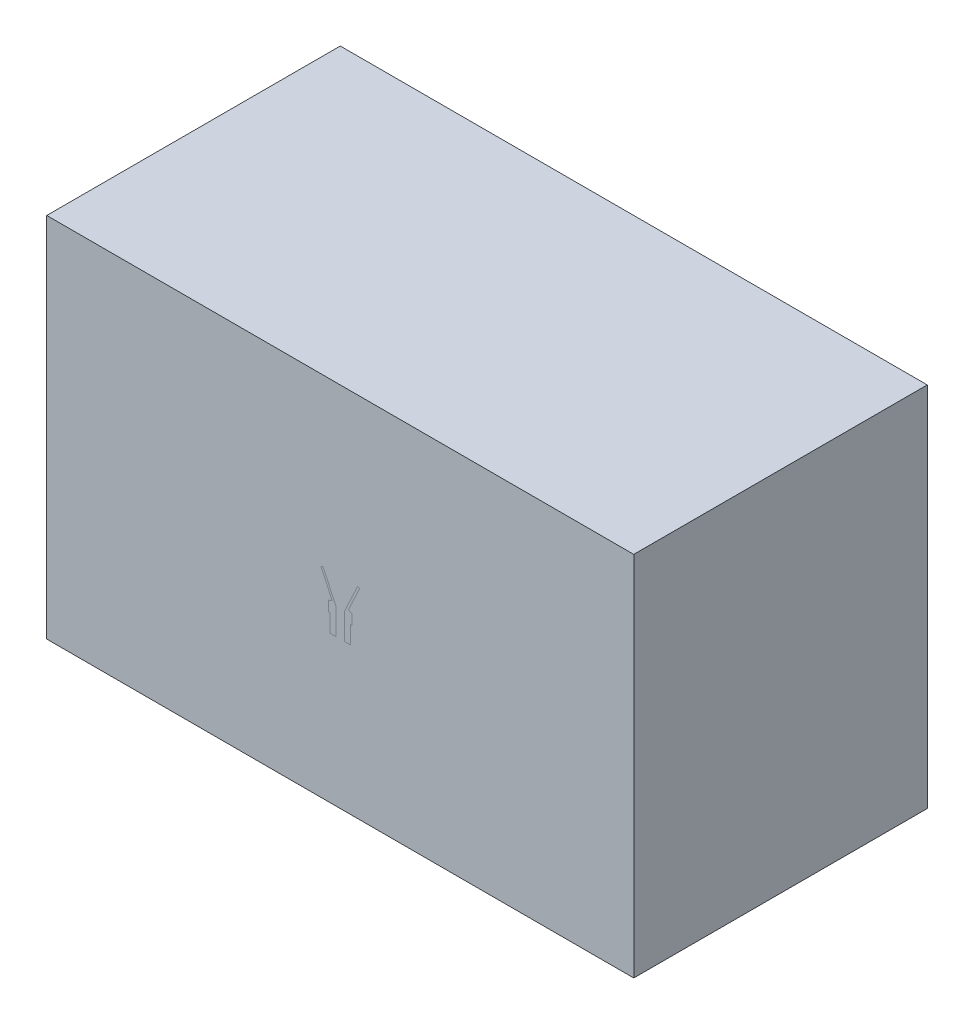
from build123d import *

# Parameters (mm, degrees)
SKETCH1_R           = 175
SKETCH1_R_2         = 75
BOSS_EXTRUDE1_DEPTH = 457
SKETCH3_W           = 10160
SKETCH3_H           = 6350
BOSS_EXTRUDE2_DEPTH = 5080
SKETCH4_W           = 13475.768327993
SKETCH4_H           = 8367.586519284
CUT_EXTRUDE1_DEPTH  = 8132.96778154


# Read off the part's stored shape, not the designer's step: Intersect1
with BuildPart() as part:
    # Sketch1 → Boss-Extrude1 (new body)
    with BuildSketch(Plane(origin=(0, 0, 0), x_dir=(1, 0, 0), z_dir=(0, 1, 0))):
        with Locations(Location((0, 0, 0), (0, 0, 270))):
            Circle(SKETCH1_R)
        with Locations(Location((0, 0, 0), (0, 0, 270))):
            Circle(SKETCH1_R_2, mode=Mode.SUBTRACT)
    extrude(amount=BOSS_EXTRUDE1_DEPTH)

    # Sketch2 → Revolve1 (revolve)
    with BuildSketch(Plane.XY, mode=Mode.PRIVATE) as revolve1_sk:
        Polygon((-175, 307), (-200.4, 307), (-200.4, 482.4), (-141.656158966, 509.792702943), (-334.953896668, 924.323380121), (-300.423535153, 940.425061203), (-107.203362165, 526.060723029), (-75, 457), (-175, 457), align=None)
    revolve(revolve1_sk.sketch.rotate(Axis((0, 0, 0), (0, 1, 0)), 270), axis=Axis((0, 0, 0), (0, 1, 0)))


with BuildPart() as body_2:
    # Sketch3 → Boss-Extrude2 (new, symmetric)
    with BuildSketch(Plane(origin=(0, 0, 0), x_dir=(0, 0, -1), z_dir=(1, 0, 0))):
        with Locations((0, 635)):
            Rectangle(SKETCH3_W, SKETCH3_H)
    extrude(amount=BOSS_EXTRUDE2_DEPTH, both=True)

    # Intersect1 outline → Intersect1 (revolve, cut)
    with BuildSketch(Plane.XY):
        Polygon((75, 457), (75, 0), (175, 0), (175, 307), (200.4, 307), (200.4, 482.4), (141.656158966, 509.792702943), (334.953896668, 924.323380121), (300.423535153, 940.425061203), align=None)
    revolve(axis=Axis((0, 0, 0), (0, 1, 0)), mode=Mode.SUBTRACT)


with BuildPart() as cut_extrude1_tool:
    # Sketch4 → Cut-Extrude1 (new, through all)
    with BuildSketch(Plane.XY):
        with Locations((454.179344916, 464.014834855)):
            Rectangle(SKETCH4_W, SKETCH4_H)
    extrude(amount=CUT_EXTRUDE1_DEPTH)


with BuildPart() as part_1:
    add(part.part)

    # Cut-Extrude1: cut by cut_extrude1_tool
    add(cut_extrude1_tool.part, mode=Mode.SUBTRACT)


with BuildPart() as body_2_1:
    add(body_2.part)

    # Cut-Extrude1: cut by cut_extrude1_tool
    add(cut_extrude1_tool.part, mode=Mode.SUBTRACT)


solid = Compound([part_1.part, body_2_1.part])
